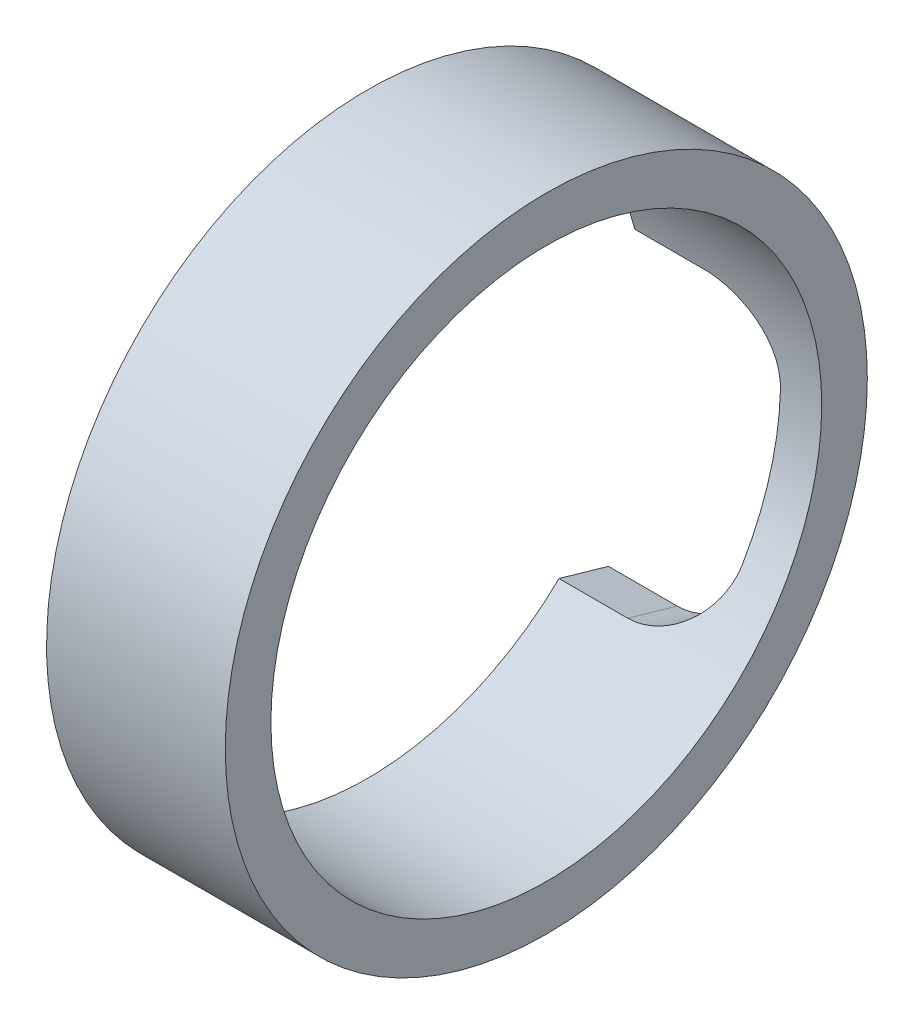
from build123d import *

# Parameters (mm, degrees)
SKETCH1_W          = 4.949999982
SKETCH1_H          = 1.263000014
CUT_EXTRUDE1_REACH = 45.42


with BuildPart() as part:
    # Sketch1 → Revolve1 (revolve)
    with BuildSketch(Plane.XY):
        with Locations((-36.903124961, 8.258499993)):
            Rectangle(SKETCH1_W, SKETCH1_H)
    revolve(axis=Axis((0, 0, 0), (-1, 0, 0)))

    # Sketch3 → Cut-Extrude1 (cut, up to next)
    with BuildSketch(Plane(origin=(0, -1.723468434, -6.010832063), x_dir=(-1, 0, 0), z_dir=(0, -0.27562111199769534, -0.9612663536300196)), mode=Mode.PRIVATE) as cut_extrude1_sk1:
        with BuildLine():
            Line((39.378124952, 3.81), (39.378124952, -3.81))
            Line((39.378124952, -3.81), (37.473124952, -3.81))
            ThreePointArc((37.473124952, -3.81), (36.126086534, -3.252038418), (35.568124952, -1.905))
            Line((35.568124952, -1.905), (35.568124952, 1.905))
            ThreePointArc((35.568124952, 1.905), (36.126086534, 3.252038418), (37.473124952, 3.81))
            Line((37.473124952, 3.81), (39.378124952, 3.81))
        make_face()
    cut_extrude1_tool1 = extrude(cut_extrude1_sk1.sketch, amount=CUT_EXTRUDE1_REACH, mode=Mode.PRIVATE) & part.part
    add(cut_extrude1_tool1.solids().sort_by_distance((-37.557, -1.723468, -6.010832))[0], mode=Mode.SUBTRACT)


solid = part.part
